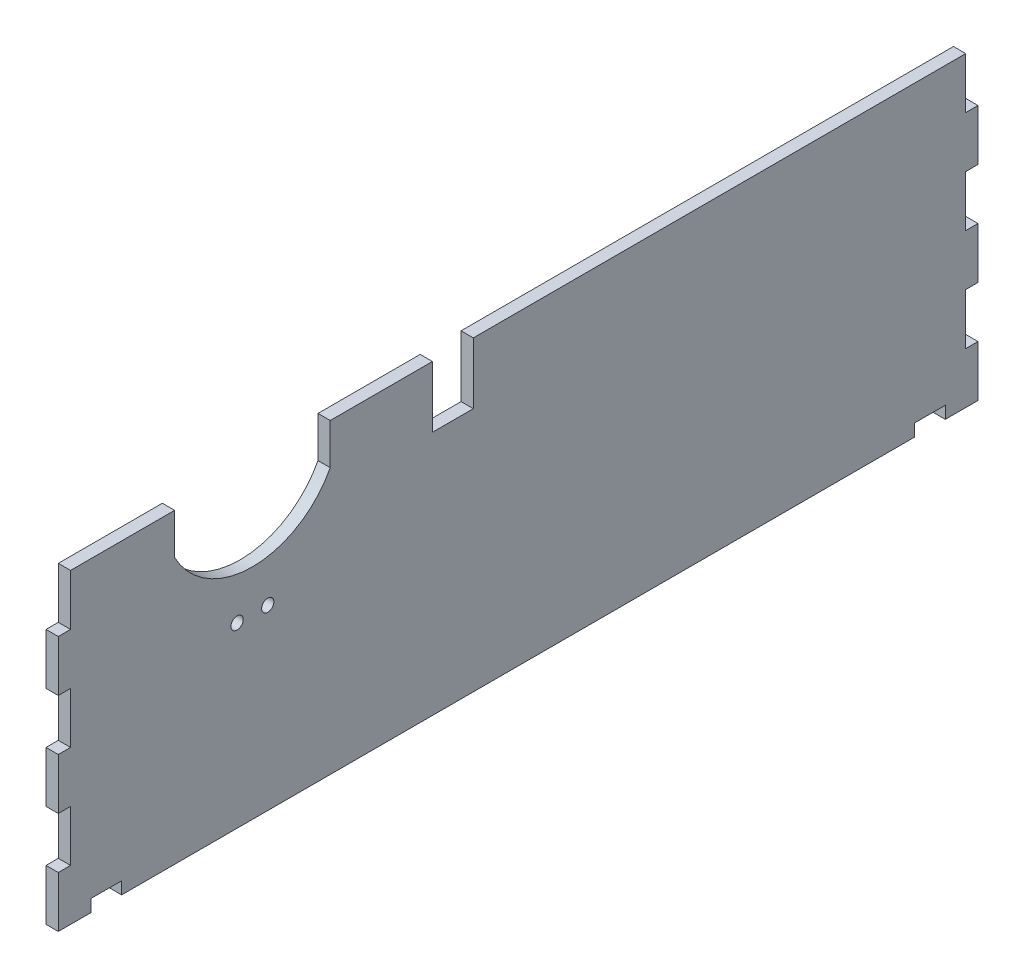
from build123d import *

# Parameters (mm, degrees)
SKETCH1_W            = 450
SKETCH1_H            = 150
BOSS_EXTRUDE1_DEPTH  = 6
SKETCH2_W            = 6
SKETCH2_H            = 25
CUT_EXTRUDE1_DEPTH   = 475.379594839
LPATTERN1_COUNT      = 3
LPATTERN1_PITCH      = 50
LPATTERN1_COUNT_DIR2 = 2
LPATTERN1_PITCH_DIR2 = 444
SKETCH3_W            = 15
SKETCH3_H            = 6
CUT_EXTRUDE2_DEPTH   = 475.379594839
LPATTERN2_COUNT      = 2
LPATTERN2_PITCH      = 403
SKETCH4_R            = 3
CUT_EXTRUDE3_DEPTH   = 10
SKETCH5_W            = 20
SKETCH5_H            = 30
CUT_EXTRUDE4_DEPTH   = 10


with BuildPart() as part:
    # Sketch1 → Boss-Extrude1 (new body)
    with BuildSketch(Plane(origin=(0, 0, 0), x_dir=(0, 0, -1), z_dir=(1, 0, 0))):
        with Locations((-225, 75)):
            Rectangle(SKETCH1_W, SKETCH1_H)
    extrude(amount=BOSS_EXTRUDE1_DEPTH)

    # Sketch2 → Cut-Extrude1 (cut, through all)
    with BuildSketch(Plane(origin=(6, 0, 0), x_dir=(0, 0, -1), z_dir=(1, 0, 0))):
        with Locations((-447, 137.5)):
            Rectangle(SKETCH2_W, SKETCH2_H)
    cut_extrude1 = extrude(amount=-CUT_EXTRUDE1_DEPTH, mode=Mode.SUBTRACT)

    # LPattern1: Cut-Extrude1 3 × 2
    with Locations(*[(0, -i * LPATTERN1_PITCH, -j * LPATTERN1_PITCH_DIR2) for i in range(LPATTERN1_COUNT) for j in range(LPATTERN1_COUNT_DIR2) if (i, j) != (0, 0)]):
        add(cut_extrude1, mode=Mode.SUBTRACT)

    # Sketch3 → Cut-Extrude2 (cut, through all)
    with BuildSketch(Plane(origin=(6, 0, 0), x_dir=(0, 0, -1), z_dir=(1, 0, 0))):
        with Locations((-426.5, 3)):
            Rectangle(SKETCH3_W, SKETCH3_H)
    cut_extrude2 = extrude(amount=-CUT_EXTRUDE2_DEPTH, mode=Mode.SUBTRACT)

    # LPattern2: Cut-Extrude2 ×2
    with Locations(*[(0, 0, -i * LPATTERN2_PITCH) for i in range(1, LPATTERN2_COUNT)]):
        add(cut_extrude2, mode=Mode.SUBTRACT)

    # Sketch4 → Cut-Extrude3 (cut)
    with BuildSketch(Plane(origin=(6, 0, 0), x_dir=(0, 0, -1), z_dir=(1, 0, 0))):
        with Locations((-362.5, 87)):
            Circle(SKETCH4_R)
        with Locations((-347.5, 87)):
            Circle(SKETCH4_R)
        with BuildLine():
            Line((-393.065732621, 130), (-393.065732621, 150))
            Line((-393.065732621, 150), (-316.934267379, 150))
            Line((-316.934267379, 150), (-316.934267379, 130))
            ThreePointArc((-316.934267379, 130), (-355, 107), (-393.065732621, 130))
        make_face()
    extrude(amount=-CUT_EXTRUDE3_DEPTH, mode=Mode.SUBTRACT)

    # Sketch5 → Cut-Extrude4 (cut)
    with BuildSketch(Plane(origin=(6, 0, 0), x_dir=(0, 0, -1), z_dir=(1, 0, 0))):
        with Locations((-256.934267379, 135)):
            Rectangle(SKETCH5_W, SKETCH5_H)
    extrude(amount=-CUT_EXTRUDE4_DEPTH, mode=Mode.SUBTRACT)


solid = part.part
